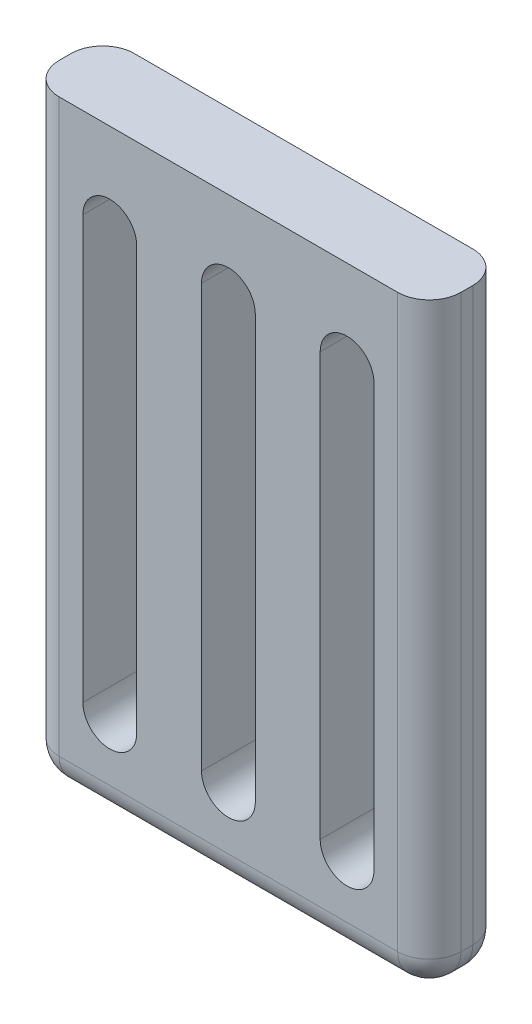
from build123d import *

# Parameters (mm, degrees)
SKETCH1_W           = 25.4
SKETCH1_H           = 38.1
BOSS_EXTRUDE1_DEPTH = 4.75
SKETCH2_W           = 3.4
SKETCH2_H           = 30.1
CUT_EXTRUDE1_DEPTH  = 24.382792819
FILLET1_R           = 1.7
FILLET2_R           = 1.7
FILLET3_R           = 1.7
FILLET4_R           = 1.7
FILLET5_R           = 2
FILLET6_R           = 1.7
FILLET7_R           = 1.7


with BuildPart() as part:
    # Sketch1 → Boss-Extrude1 (new body)
    with BuildSketch(Plane.XY):
        Rectangle(SKETCH1_W, SKETCH1_H)
    extrude(amount=BOSS_EXTRUDE1_DEPTH)

    # Sketch2 → Cut-Extrude1 (cut, through all)
    with BuildSketch(Plane.XY.offset(4.75)):
        with Locations((7.5, 0)):
            Rectangle(SKETCH2_W, SKETCH2_H)
        with Locations((-7.5, 0)):
            Rectangle(SKETCH2_W, SKETCH2_H)
        Rectangle(SKETCH2_W, SKETCH2_H)
    extrude(amount=-CUT_EXTRUDE1_DEPTH, mode=Mode.SUBTRACT)

    # Fillet1
    fillet1_edges = [part.edges().sort_by_distance(p)[0] for p in [
        (-5.8, 15.05, 2.375),
        (-9.2, 15.05, 2.375),
    ]]
    fillet(fillet1_edges, radius=FILLET1_R - 0.0001)  # a hair under: the kernel refuses the full size

    # Fillet2
    fillet2_edges = [part.edges().sort_by_distance(p)[0] for p in [
        (-5.8, -15.05, 2.375),
        (-9.2, -15.05, 2.375),
    ]]
    fillet(fillet2_edges, radius=FILLET2_R - 0.0001)  # a hair under: the kernel refuses the full size

    # Fillet3
    fillet3_edges = [part.edges().sort_by_distance(p)[0] for p in [
        (9.2, 15.05, 2.375),
        (5.8, 15.05, 2.375),
    ]]
    fillet(fillet3_edges, radius=FILLET3_R - 0.0001)  # a hair under: the kernel refuses the full size

    # Fillet4
    fillet4_edges = [part.edges().sort_by_distance(p)[0] for p in [
        (9.2, -15.05, 2.375),
        (5.8, -15.05, 2.375),
    ]]
    fillet(fillet4_edges, radius=FILLET4_R - 0.0001)  # a hair under: the kernel refuses the full size

    # Fillet5
    fillet5_edges = [part.edges().sort_by_distance(p)[0] for p in [
        (-12.7, 0, 4.75),
        (0, -19.05, 4.75),
        (12.7, 0, 4.75),
        (0, -19.05, 0),
        (-12.7, 0, 0),
        (12.7, 0, 0),
        (12.7, -19.05, 2.375),
        (-12.7, -19.05, 2.375),
    ]]
    fillet(fillet5_edges, radius=FILLET5_R)

    # Fillet6
    fillet6_edges = [part.edges().sort_by_distance(p)[0] for p in [
        (1.7, 15.05, 2.375),
        (-1.7, 15.05, 2.375),
    ]]
    fillet(fillet6_edges, radius=FILLET6_R - 0.0001)  # a hair under: the kernel refuses the full size

    # Fillet7
    fillet7_edges = [part.edges().sort_by_distance(p)[0] for p in [
        (1.7, -15.05, 2.375),
        (-1.7, -15.05, 2.375),
    ]]
    fillet(fillet7_edges, radius=FILLET7_R - 0.0001)  # a hair under: the kernel refuses the full size


solid = part.part
